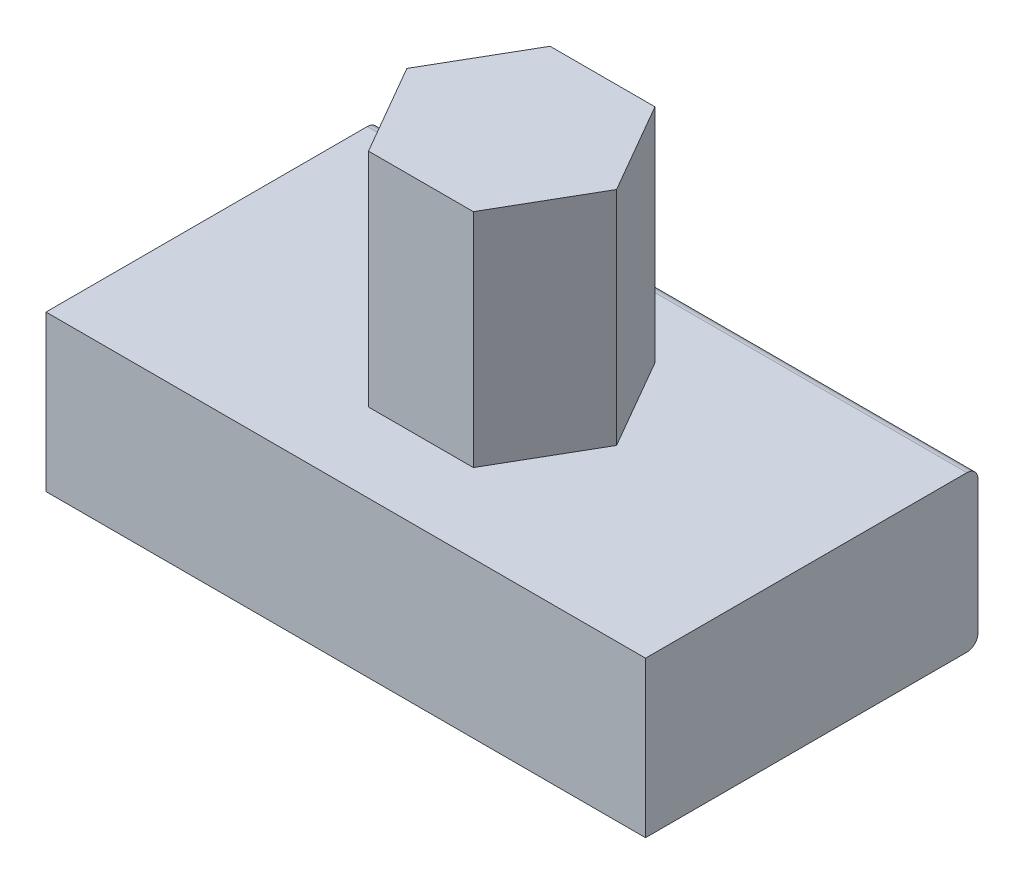
from build123d import *

# Parameters (mm, degrees)
SKETCH1_W           = 137.407001984
SKETCH1_H           = 35.641957088
BOSS_EXTRUDE1_DEPTH = 76.2
BOSS_EXTRUDE2_DEPTH = 50.8
FILLET2_R           = 2.54


with BuildPart() as part:
    # Sketch1 → Boss-Extrude1 (new body)
    with BuildSketch(Plane.XY):
        Rectangle(SKETCH1_W, SKETCH1_H)
    extrude(amount=BOSS_EXTRUDE1_DEPTH)

    # Sketch2 → Boss-Extrude2 (add)
    with BuildSketch(Plane(origin=(0, 17.820978544, 0), x_dir=(1, 0, 0), z_dir=(0, 1, 0))):
        Polygon((23.159003861, -37.290679973), (11.143714224, -16.479587852), (-12.886865052, -16.479587852), (-24.90215469, -37.290679973), (-12.886865052, -58.101772093), (11.143714224, -58.101772093), align=None)
    extrude(amount=BOSS_EXTRUDE2_DEPTH)

    # Fillet2
    fillet2_edges = [part.edges().sort_by_distance(p)[0] for p in [
        (0, -17.820978544, 0),
        (0, 17.820978544, 0),
    ]]
    fillet(fillet2_edges, radius=FILLET2_R)


solid = part.part
